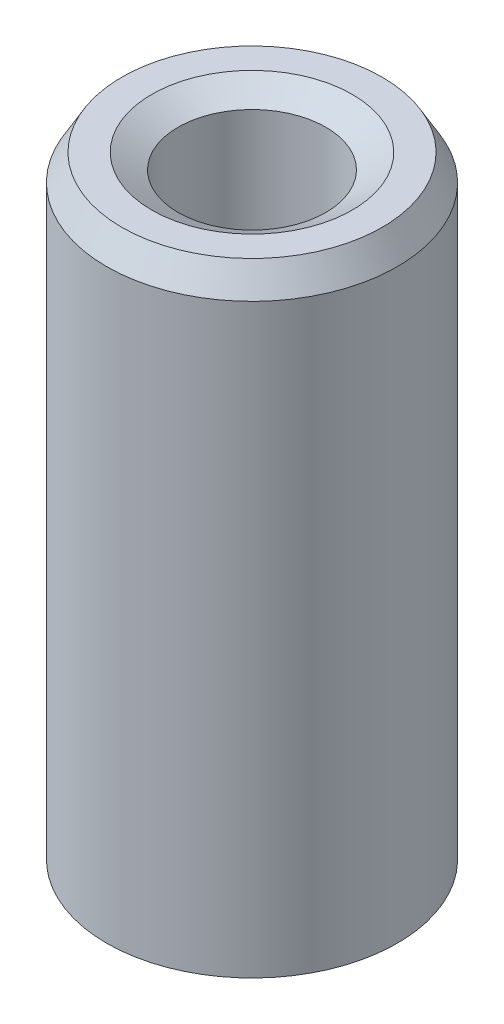
from build123d import *
from OCP.BRepFilletAPI import BRepFilletAPI_MakeChamfer

# Parameters (mm, degrees)
SKETCH1_R           = 7.5
BOSS_EXTRUDE1_DEPTH = 32.377585722
SKETCH2_R           = 3.812414727
CUT_EXTRUDE1_DEPTH  = 35.070633355
CHAMFER1_SIZE       = 1.360770505
CHAMFER1_SIZE2      = 0.785641217


with BuildPart() as part:
    # Sketch1 → Boss-Extrude1 (new body)
    with BuildSketch(Plane(origin=(0, 0, 0), x_dir=(1, 0, 0), z_dir=(0, 1, 0))):
        Circle(SKETCH1_R)
    extrude(amount=BOSS_EXTRUDE1_DEPTH)

    # Sketch2 → Cut-Extrude1 (cut, through all)
    with BuildSketch(Plane(origin=(0, 0, 0), x_dir=(1, 0, 0), z_dir=(0, 1, 0))):
        Circle(SKETCH2_R)
    extrude(amount=CUT_EXTRUDE1_DEPTH, mode=Mode.SUBTRACT)

    # Chamfer1: one chamfer whose edges measure the first distance from different faces: ONE call of the kernel's chamfer builder (chamfer() names one face for all edges)
    chamfer1_edges_1 = [part.edges().sort_by_distance(p)[0] for p in [
        (-3.812414727, 32.377585722, 0),
    ]]
    chamfer1_side_1 = [part.faces().sort_by_distance(p)[0] for p in [
        (-7.287867966, 32.377585722, 0),
    ]]
    chamfer1_edges_2 = [part.edges().sort_by_distance(p)[0] for p in [
        (-3.812414727, 0, 0),
    ]]
    chamfer1_side_2 = [part.faces().sort_by_distance(p)[0] for p in [
        (-3.812414727, 16.188792861, 0),
    ]]
    chamfer1_edges_3 = [part.edges().sort_by_distance(p)[0] for p in [
        (-7.5, 0, 0),
    ]]
    chamfer1_side_3 = [part.faces().sort_by_distance(p)[0] for p in [
        (-7.287867966, 0, 0),
    ]]
    chamfer1_edges_4 = [part.edges().sort_by_distance(p)[0] for p in [
        (-7.5, 32.377585722, 0),
    ]]
    chamfer1_side_4 = [part.faces().sort_by_distance(p)[0] for p in [
        (-7.5, 16.188792861, 0),
    ]]
    chamfer1 = BRepFilletAPI_MakeChamfer(part.part.solid().wrapped)
    for e in chamfer1_edges_1:
        chamfer1.Add(CHAMFER1_SIZE, CHAMFER1_SIZE2, e.wrapped, chamfer1_side_1[0].wrapped)  # the first distance lies on this face
    for e in chamfer1_edges_2:
        chamfer1.Add(CHAMFER1_SIZE, CHAMFER1_SIZE2, e.wrapped, chamfer1_side_2[0].wrapped)  # the first distance lies on this face
    for e in chamfer1_edges_3:
        chamfer1.Add(CHAMFER1_SIZE, CHAMFER1_SIZE2, e.wrapped, chamfer1_side_3[0].wrapped)  # the first distance lies on this face
    for e in chamfer1_edges_4:
        chamfer1.Add(CHAMFER1_SIZE, CHAMFER1_SIZE2, e.wrapped, chamfer1_side_4[0].wrapped)  # the first distance lies on this face
    add(Compound.cast(chamfer1.Shape()), mode=Mode.REPLACE)


solid = part.part
